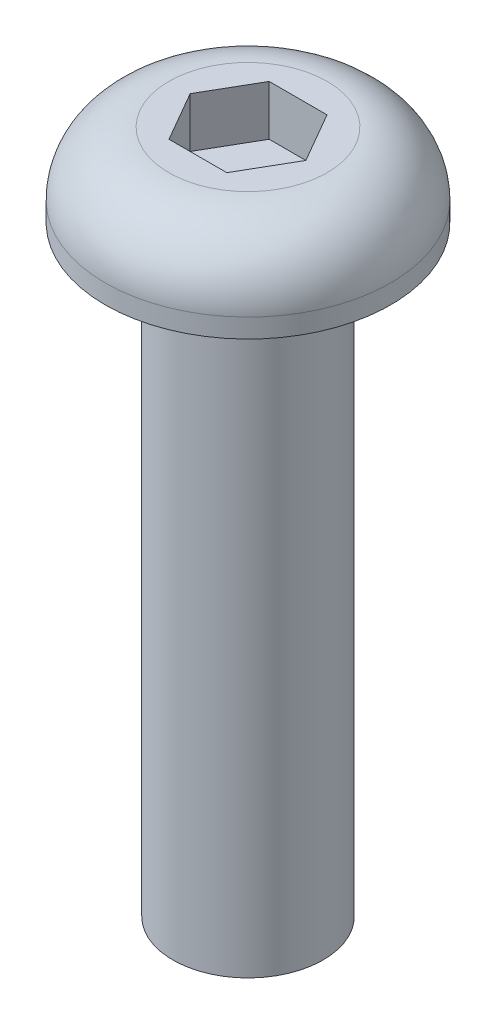
from build123d import *

# Parameters (mm, degrees)
CUT_EXTRUDE1_DEPTH = 1


with BuildPart() as part:
    # Sketch1 → Revolve1 (revolve)
    with BuildSketch(Plane.XY):
        with BuildLine():
            Line((1.5, 0), (2.85, 0))
            Line((2.85, 0), (2.85, 0.38))
            ThreePointArc((2.85, 0.38), (2.478025612, 1.278025612), (1.58, 1.65))
            Line((1.58, 1.65), (0, 1.65))
            Line((0, 1.65), (0, -12))
            Line((0, -12), (1.5, -12))
            Line((1.5, -12), (1.5, 0))
        make_face()
    revolve(axis=Axis((0, -12, 0), (0, 1, 0)))

    # Sketch2 → Cut-Extrude1 (cut)
    with BuildSketch(Plane(origin=(0, 1.65, 0), x_dir=(1, 0, 0), z_dir=(0, 1, 0))):
        Polygon((0.577350269, 1), (-0.577350269, 1), (-1.154700538, 0), (-0.577350269, -1), (0.577350269, -1), (1.154700538, 0), align=None)
    extrude(amount=-CUT_EXTRUDE1_DEPTH, mode=Mode.SUBTRACT)


solid = part.part
